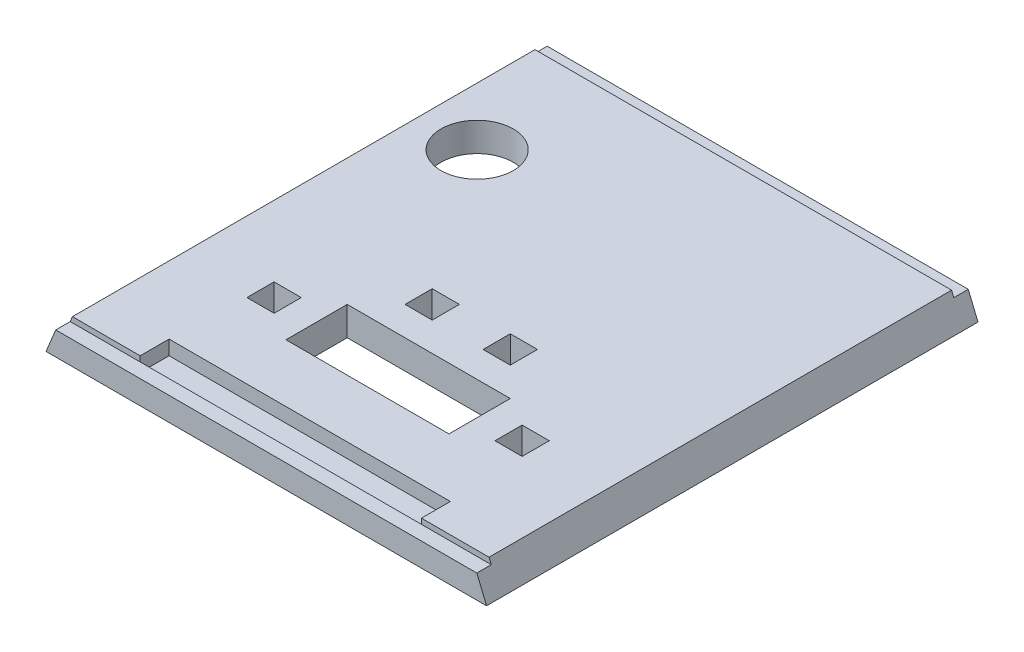
from build123d import *

# Parameters (mm, degrees)
BOSS_EXTRUDE1_DEPTH = 215.9
SKETCH2_W           = 193.548
SKETCH2_H           = 6.35
CUT_EXTRUDE1_DEPTH  = 2.3622
SKETCH3_W           = 71.628
SKETCH3_H           = 26.924
SKETCH3_W_2         = 11.938
SKETCH3_H_2         = 11.938
CUT_EXTRUDE3_DEPTH  = 291.232541773
SKETCH4_R           = 15.875
CUT_EXTRUDE4_DEPTH  = 291.232541773
CAVITY1_START       = 196.85
CAVITY1_OUTLINE_W   = 123.569632405
CAVITY1_OUTLINE_H   = 6.35
CAVITY1_DEPTH       = 12.7


# Read off the part's stored shape, not the designer's step: Cavity1
with BuildPart() as part:
    # Sketch1 → Boss-Extrude1 (new body)
    with BuildSketch(Plane.XY):
        Polygon((0, 0), (5.260512242, 12.7), (188.287487758, 12.7), (193.548, 0), align=None)
    extrude(amount=BOSS_EXTRUDE1_DEPTH)

    # Sketch2 → Cut-Extrude1 (cut)
    with BuildSketch(Plane.XZ.offset(-12.7)):
        with Locations((96.774, 3.175)):
            Rectangle(SKETCH2_W, SKETCH2_H)
        with Locations((96.774, 212.725)):
            Rectangle(SKETCH2_W, SKETCH2_H)
    extrude(amount=CUT_EXTRUDE1_DEPTH, mode=Mode.SUBTRACT)

    # Sketch3 → Cut-Extrude3 (cut, through all)
    with BuildSketch(Plane.XZ):
        with Locations((96.774, 157.988)):
            Rectangle(SKETCH3_W, SKETCH3_H)
        with Locations((79.629, 125.857)):
            Rectangle(SKETCH3_W_2, SKETCH3_H_2)
        with Locations((113.919, 125.857)):
            Rectangle(SKETCH3_W_2, SKETCH3_H_2)
        with Locations((151.257, 157.988)):
            Rectangle(SKETCH3_W_2, SKETCH3_H_2)
        with Locations((42.291, 157.988)):
            Rectangle(SKETCH3_W_2, SKETCH3_H_2)
    extrude(amount=-CUT_EXTRUDE3_DEPTH, mode=Mode.SUBTRACT)

    # Sketch4 → Cut-Extrude4 (cut, through all)
    with BuildSketch(Plane(origin=(0, 12.7, 0), x_dir=(1, 0, 0), z_dir=(0, 1, 0))):
        with Locations(Location((30.660512242, -57.15, 0), (0, 0, 180))):
            Circle(SKETCH4_R)
    extrude(amount=-CUT_EXTRUDE4_DEPTH, mode=Mode.SUBTRACT)

    # Cavity1 outline → Cavity1 (cut)
    with BuildSketch(Plane.XY.offset(CAVITY1_START)):
        with Locations((96.808185153, 9.525)):
            Rectangle(CAVITY1_OUTLINE_W, CAVITY1_OUTLINE_H)
    extrude(amount=CAVITY1_DEPTH, mode=Mode.SUBTRACT)


solid = part.part
